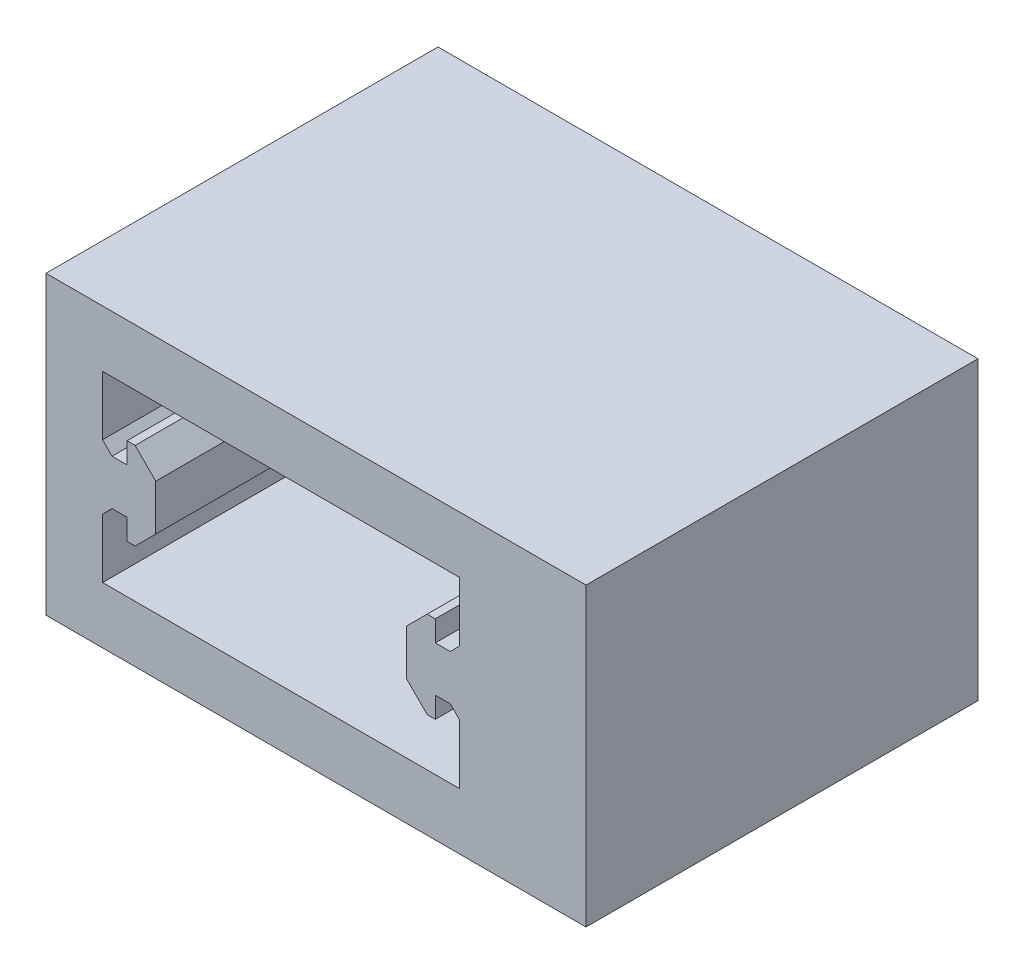
from build123d import *

# Parameters (mm, degrees)
SKETCH1_W           = 62
SKETCH1_H           = 34
BOSS_EXTRUDE1_DEPTH = 45


with BuildPart() as part:
    # Sketch1 → Boss-Extrude1 (new body)
    with BuildSketch(Plane.XY.offset(118.939676155)):
        with Locations((-8.780385216, 18.846978354)):
            Rectangle(SKETCH1_W, SKETCH1_H)
        Polygon((-33.280385216, 29.346978354), (-33.280385216, 22.547705171), (-32.198703986, 21.446978354), (-30.480385216, 21.446978354), (-30.480385216, 23.846978354), (-29.548152169, 23.846978354), (-27.180385216, 21.479211401), (-27.180385216, 16.214745307), (-29.548152169, 13.846978354), (-30.480385216, 13.846978354), (-30.480385216, 16.246978354), (-32.198703986, 16.246978354), (-33.280385216, 15.146251537), (-33.280385216, 8.346978354), (7.719614784, 8.346978354), (7.719614784, 15.146251537), (6.637933553, 16.246978354), (4.919614784, 16.246978354), (4.919614784, 13.846978354), (3.987381737, 13.846978354), (1.619614784, 16.214745307), (1.619614784, 21.479211401), (3.987381737, 23.846978354), (4.919614784, 23.846978354), (4.919614784, 21.446978354), (6.637933553, 21.446978354), (7.719614784, 22.547705171), (7.719614784, 29.346978354), align=None, mode=Mode.SUBTRACT)
    extrude(amount=-BOSS_EXTRUDE1_DEPTH)


solid = part.part
